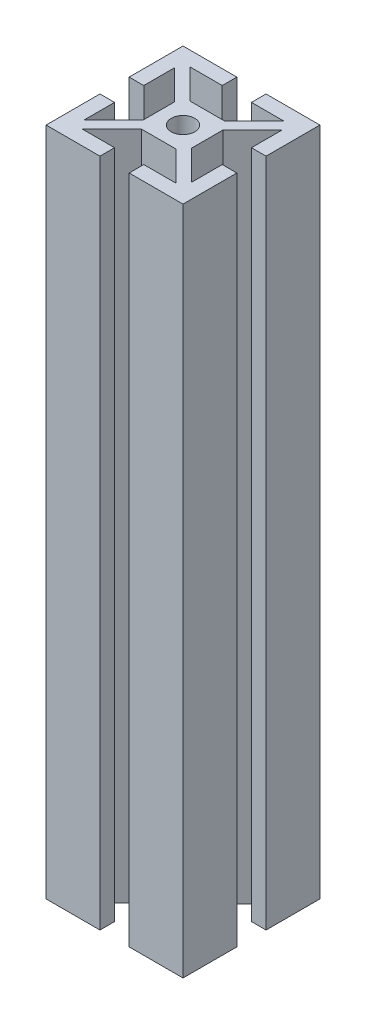
from build123d import *

# Parameters (mm, degrees)
EXTRUDE1_DEPTH = 186.5376


# Read off the part's stored shape, not the designer's step: 1515<1>
with BuildPart() as part:
    # Sketch1<2> → Extrude1 (new body)
    with BuildSketch(Plane(origin=(0, 0, 0), x_dir=(1, 0, 0), z_dir=(0, 1, 0))):
        Polygon((-6.7564, 4.364749804), (-6.7564, -4.364749804), (-14.986, -12.594349804), (-14.986, -4.064), (-19.05, -4.064), (-19.05, -19.05), (-4.064, -19.05), (-4.064, -14.986), (-13.067127258, -14.986), (-4.837527258, -6.7564), (4.837527258, -6.7564), (13.067127258, -14.986), (4.064, -14.986), (4.064, -19.05), (19.05, -19.05), (19.05, -4.064), (14.986, -4.064), (14.986, -12.594349804), (6.7564, -4.364749804), (6.7564, 4.364749804), (14.986, 12.594349804), (14.986, 4.064), (19.05, 4.064), (19.05, 19.05), (4.064, 19.05), (4.064, 14.986), (13.067127258, 14.986), (4.837527258, 6.7564), (-4.837527258, 6.7564), (-13.067127258, 14.986), (-4.064, 14.986), (-4.064, 19.05), (-19.05, 19.05), (-19.05, 4.064), (-14.986, 4.064), (-14.986, 12.594349804), align=None)
    extrude(amount=EXTRUDE1_DEPTH)

    # Sketch2 → 5/16-18 Tapped Hole1 (revolve, cut)
    with BuildSketch(Plane(origin=(0, 186.5376, 0), x_dir=(0, 0, 1), z_dir=(1, 0, 0))):
        Polygon((0, 0), (0, 33.711148974), (3.2639, 31.75), (3.2639, 0), align=None)
    f_5_16_18_tapped_hole1 = revolve(axis=Axis((0, 192.8876, 0), (0, -1, 0)), mode=Mode.SUBTRACT)

    # Mirror1: 5/16-18 Tapped Hole1 across plane
    add(f_5_16_18_tapped_hole1.mirror(Plane.ZX.offset(93.2688)), mode=Mode.SUBTRACT)


solid = part.part
